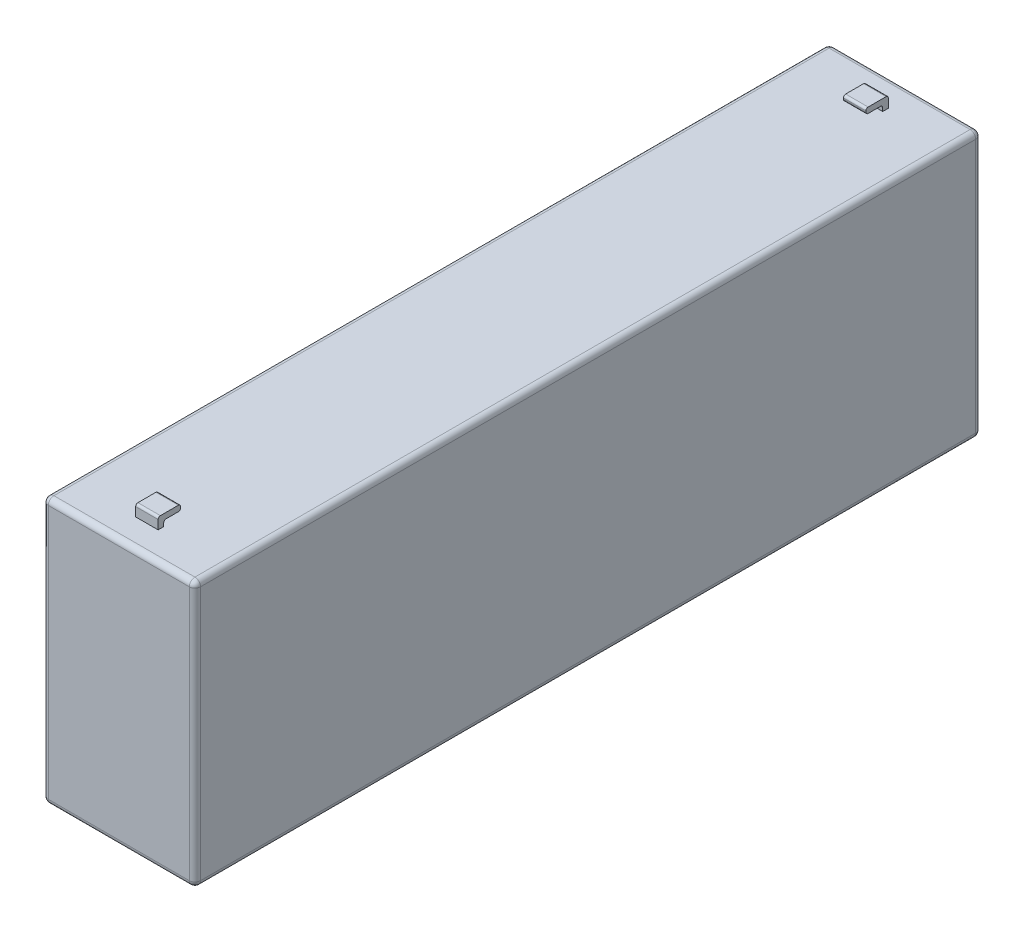
from build123d import *

# Parameters (mm, degrees)
SKETCH1_W           = 34.417
SKETCH1_H           = 177.8
BOSS_EXTRUDE1_DEPTH = 60.071
FILLET1_R           = 1.27
FILLET2_R           = 1.27
BOSS_EXTRUDE2_DEPTH = 2.54


with BuildPart() as part:
    # Sketch1 → Boss-Extrude1 (new body)
    with BuildSketch(Plane(origin=(0, 0, 0), x_dir=(1, 0, 0), z_dir=(0, 1, 0))):
        Rectangle(SKETCH1_W, SKETCH1_H)
    extrude(amount=BOSS_EXTRUDE1_DEPTH)

    # Fillet1
    fillet1_edges = [part.edges().sort_by_distance(p)[0] for p in [
        (17.2085, 60.071, 0),
        (0, 60.071, -88.9),
        (-17.2085, 60.071, 0),
        (0, 0, -88.9),
        (17.2085, 0, 0),
        (0, 0, 88.9),
        (-17.2085, 0, 0),
        (0, 60.071, 88.9),
    ]]
    fillet(fillet1_edges, radius=FILLET1_R)

    # Fillet2
    # the kernel refuses this fillet: 1.27 mm, written as the material it takes off along each edge
    with BuildSketch(Plane(origin=(-15.9385, 1.27, -87.63), x_dir=(0, 0, -1), z_dir=(-1, 0, 0))) as fillet2_piece_1_section:
        Polygon((0, 0), (FILLET2_R * 1.02, 0), (FILLET2_R * 1.02, FILLET2_R * 1.02), (0, FILLET2_R * 1.02), align=None)
    fillet2_piece_1 = extrude(amount=FILLET2_R * 1.02, mode=Mode.PRIVATE)
    fillet2_piece_1 = fillet2_piece_1 - Plane(origin=(-15.9385, 1.27, -87.63), x_dir=(0, 0.7071067811865475, 0.7071067811865475), z_dir=(-1, 0, 0)) * Sphere(FILLET2_R, mode=Mode.PRIVATE)
    add(fillet2_piece_1, mode=Mode.SUBTRACT)
    with BuildSketch(Plane(origin=(15.9385, 1.27, -87.63), x_dir=(0, 0, -1), z_dir=(1, 0, 0))) as fillet2_piece_2_section:
        Polygon((0, 0), (FILLET2_R * 1.02, 0), (FILLET2_R * 1.02, -FILLET2_R * 1.02), (0, -FILLET2_R * 1.02), align=None)
    fillet2_piece_2 = extrude(amount=FILLET2_R * 1.02, mode=Mode.PRIVATE)
    fillet2_piece_2 = fillet2_piece_2 - Plane(origin=(15.9385, 1.27, -87.63), x_dir=(0, 0.7071067811865475, 0.7071067811865475), z_dir=(1, 0, 0)) * Sphere(FILLET2_R, mode=Mode.PRIVATE)
    add(fillet2_piece_2, mode=Mode.SUBTRACT)
    with BuildSketch(Plane(origin=(-15.9385, 1.27, 87.63), x_dir=(-1, 0, 0), z_dir=(0, 0, 1))) as fillet2_piece_3_section:
        Polygon((0, 0), (FILLET2_R * 1.02, 0), (FILLET2_R * 1.02, FILLET2_R * 1.02), (0, FILLET2_R * 1.02), align=None)
    fillet2_piece_3 = extrude(amount=FILLET2_R * 1.02, mode=Mode.PRIVATE)
    fillet2_piece_3 = fillet2_piece_3 - Plane(origin=(-15.9385, 1.27, 87.63), x_dir=(0.7071067811865475, 0.7071067811865475, 0), z_dir=(0, 0, 1)) * Sphere(FILLET2_R, mode=Mode.PRIVATE)
    add(fillet2_piece_3, mode=Mode.SUBTRACT)
    with BuildSketch(Plane(origin=(15.9385, 1.27, 87.63), x_dir=(1, 0, 0), z_dir=(0, 0, 1))) as fillet2_piece_4_section:
        Polygon((0, 0), (FILLET2_R * 1.02, 0), (FILLET2_R * 1.02, -FILLET2_R * 1.02), (0, -FILLET2_R * 1.02), align=None)
    fillet2_piece_4 = extrude(amount=FILLET2_R * 1.02, mode=Mode.PRIVATE)
    fillet2_piece_4 = fillet2_piece_4 - Plane(origin=(15.9385, 1.27, 87.63), x_dir=(-0.7071067811865475, 0.7071067811865475, 0), z_dir=(0, 0, 1)) * Sphere(FILLET2_R, mode=Mode.PRIVATE)
    add(fillet2_piece_4, mode=Mode.SUBTRACT)
    with BuildSketch(Plane(origin=(15.9385, 58.801, 87.63), x_dir=(1, 0, 0), z_dir=(0, 0, 1))) as fillet2_piece_5_section:
        Polygon((0, 0), (FILLET2_R * 1.02, 0), (FILLET2_R * 1.02, FILLET2_R * 1.02), (0, FILLET2_R * 1.02), align=None)
    fillet2_piece_5 = extrude(amount=FILLET2_R * 1.02, mode=Mode.PRIVATE)
    fillet2_piece_5 = fillet2_piece_5 - Plane(origin=(15.9385, 58.801, 87.63), x_dir=(-0.7071067811865475, -0.7071067811865475, 0), z_dir=(0, 0, 1)) * Sphere(FILLET2_R, mode=Mode.PRIVATE)
    add(fillet2_piece_5, mode=Mode.SUBTRACT)
    with BuildSketch(Plane(origin=(-15.9385, 58.801, 87.63), x_dir=(-1, 0, 0), z_dir=(0, 0, 1))) as fillet2_piece_6_section:
        Polygon((0, 0), (FILLET2_R * 1.02, 0), (FILLET2_R * 1.02, -FILLET2_R * 1.02), (0, -FILLET2_R * 1.02), align=None)
    fillet2_piece_6 = extrude(amount=FILLET2_R * 1.02, mode=Mode.PRIVATE)
    fillet2_piece_6 = fillet2_piece_6 - Plane(origin=(-15.9385, 58.801, 87.63), x_dir=(0.7071067811865475, -0.7071067811865475, 0), z_dir=(0, 0, 1)) * Sphere(FILLET2_R, mode=Mode.PRIVATE)
    add(fillet2_piece_6, mode=Mode.SUBTRACT)
    with BuildSketch(Plane(origin=(15.9385, 58.801, -87.63), x_dir=(0, 0, -1), z_dir=(1, 0, 0))) as fillet2_piece_7_section:
        Polygon((0, 0), (FILLET2_R * 1.02, 0), (FILLET2_R * 1.02, FILLET2_R * 1.02), (0, FILLET2_R * 1.02), align=None)
    fillet2_piece_7 = extrude(amount=FILLET2_R * 1.02, mode=Mode.PRIVATE)
    fillet2_piece_7 = fillet2_piece_7 - Plane(origin=(15.9385, 58.801, -87.63), x_dir=(0, -0.7071067811865475, 0.7071067811865475), z_dir=(1, 0, 0)) * Sphere(FILLET2_R, mode=Mode.PRIVATE)
    add(fillet2_piece_7, mode=Mode.SUBTRACT)
    with BuildSketch(Plane(origin=(-15.9385, 58.801, -87.63), x_dir=(0, 0, -1), z_dir=(-1, 0, 0))) as fillet2_piece_8_section:
        Polygon((0, 0), (FILLET2_R * 1.02, 0), (FILLET2_R * 1.02, -FILLET2_R * 1.02), (0, -FILLET2_R * 1.02), align=None)
    fillet2_piece_8 = extrude(amount=FILLET2_R * 1.02, mode=Mode.PRIVATE)
    fillet2_piece_8 = fillet2_piece_8 - Plane(origin=(-15.9385, 58.801, -87.63), x_dir=(0, -0.7071067811865475, 0.7071067811865475), z_dir=(-1, 0, 0)) * Sphere(FILLET2_R, mode=Mode.PRIVATE)
    add(fillet2_piece_8, mode=Mode.SUBTRACT)
    with BuildSketch(Plane(origin=(17.2085, 1.27, 88.9), x_dir=(-1, 0, 0), z_dir=(0, 1, 0)), Plane(origin=(17.2085, 1.27, -88.9), x_dir=(0, 0, 1), z_dir=(0, 1, 0))) as fillet2_piece_9:
        with BuildLine():
            CenterArc((FILLET2_R, -FILLET2_R), FILLET2_R, 90, 90)
            Line((0, -FILLET2_R), (0, 0))
            Line((0, 0), (FILLET2_R, 0))
        make_face()
    extrude(amount=57.531, mode=Mode.SUBTRACT)
    with BuildSketch(Plane(origin=(-17.2085, 1.27, 88.9), x_dir=(1, 0, 0), z_dir=(0, 1, 0)), Plane(origin=(-17.2085, 1.27, -88.9), x_dir=(0, 0, 1), z_dir=(0, 1, 0))) as fillet2_piece_10:
        with BuildLine():
            CenterArc((FILLET2_R, FILLET2_R), FILLET2_R, 180, 90)
            Line((0, FILLET2_R), (0, 0))
            Line((0, 0), (FILLET2_R, 0))
        make_face()
    extrude(amount=57.531, mode=Mode.SUBTRACT)

    # Sketch2 → Boss-Extrude2 (add, symmetric)
    with BuildSketch(Plane(origin=(0, 0, 0), x_dir=(0, 0, -1), z_dir=(1, 0, 0))):
        with BuildLine():
            Line((-82.55, 60.071), (-82.55, 62.103))
            ThreePointArc((-82.55, 62.103), (-82.401210245, 62.462210245), (-82.042, 62.611))
            Line((-82.042, 62.611), (-77.978, 62.611))
            ThreePointArc((-77.978, 62.611), (-77.618789755, 62.462210245), (-77.47, 62.103))
            Line((-77.47, 62.103), (-77.47, 61.849))
            ThreePointArc((-77.47, 61.849), (-77.618789755, 61.489789755), (-77.978, 61.341))
            Line((-77.978, 61.341), (-80.772, 61.341))
            ThreePointArc((-80.772, 61.341), (-81.131210245, 61.192210245), (-81.28, 60.833))
            Line((-81.28, 60.833), (-81.28, 60.071))
            Line((-81.28, 60.071), (-82.55, 60.071))
        make_face()
    boss_extrude2 = extrude(amount=BOSS_EXTRUDE2_DEPTH, both=True)

    # Mirror1: Boss-Extrude2 across plane
    add(boss_extrude2.mirror(Plane.XY))


solid = part.part
